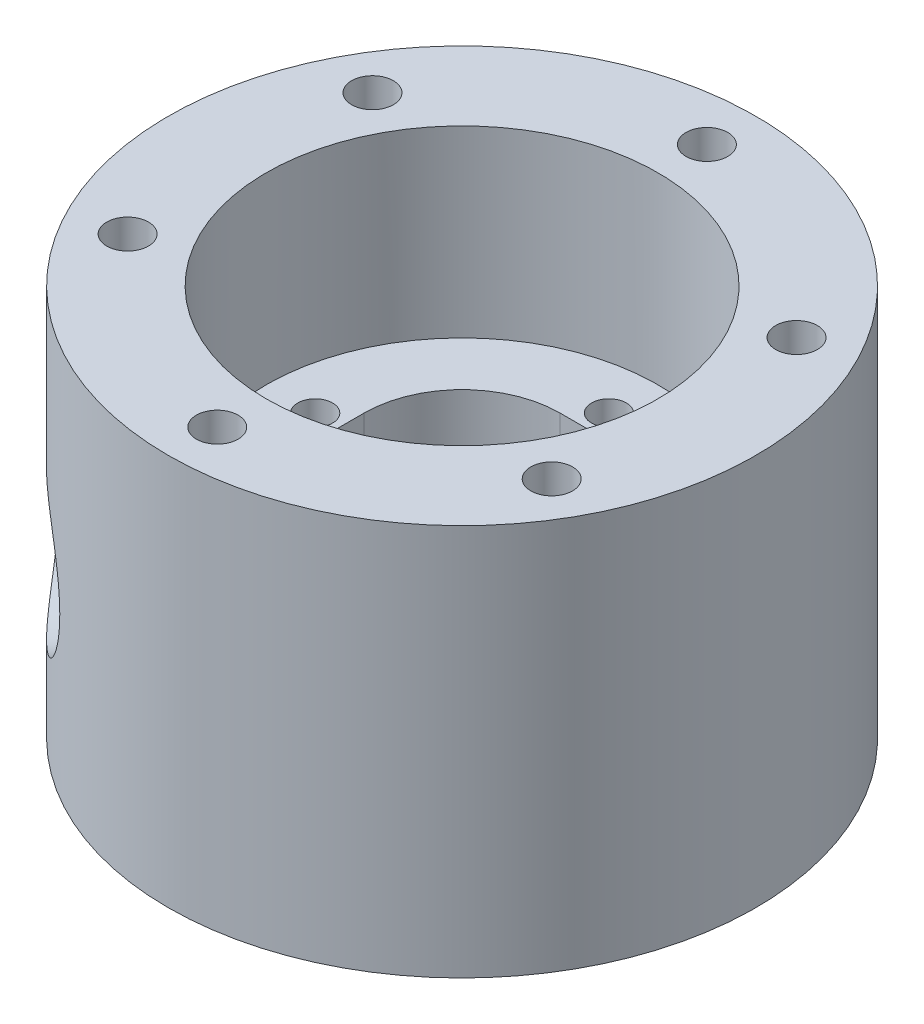
from build123d import *

# Parameters (mm, degrees)
SKETCH1_R             = 19.05
BOSS_EXTRUDE1_DEPTH   = 25.4
SKETCH3_R             = 11.1125
CUT_EXTRUDE1_DEPTH    = 7.14375
CUT_EXTRUDE2_DEPTH    = 18.25625
SKETCH5_R             = 12.7
CUT_EXTRUDE3_DEPTH    = 11.90625
F_4_40_TAPPED_HOLE1_D = 2.2606
CIRPATTERN1_COUNT     = 4
SKETCH8_R             = 4.7625
CUT_EXTRUDE6_DEPTH    = 38.026544532
CIRPATTERN2_COUNT     = 6


with BuildPart() as part:
    # Sketch1 → Boss-Extrude1 (new body)
    with BuildSketch(Plane(origin=(0, 0, 0), x_dir=(1, 0, 0), z_dir=(0, 1, 0))):
        Circle(SKETCH1_R)
    extrude(amount=BOSS_EXTRUDE1_DEPTH)

    # Sketch3 → Cut-Extrude1 (cut)
    with BuildSketch(Plane.XZ):
        Circle(SKETCH3_R)
    extrude(amount=-CUT_EXTRUDE1_DEPTH, mode=Mode.SUBTRACT)

    # Sketch4 → Cut-Extrude2 (cut)
    with BuildSketch(Plane(origin=(0, 25.4, 0), x_dir=(1, 0, 0), z_dir=(0, 1, 0))):
        with BuildLine():
            Line((-1.5875, 7.9375), (1.5875, 7.9375))
            ThreePointArc((1.5875, 7.9375), (6.077628061, 6.077628061), (7.9375, 1.5875))
            Line((7.9375, 1.5875), (7.9375, -1.5875))
            ThreePointArc((7.9375, -1.5875), (6.077628061, -6.077628061), (1.5875, -7.9375))
            Line((1.5875, -7.9375), (-1.5875, -7.9375))
            ThreePointArc((-1.5875, -7.9375), (-6.077628061, -6.077628061), (-7.9375, -1.5875))
            Line((-7.9375, -1.5875), (-7.9375, 1.5875))
            ThreePointArc((-7.9375, 1.5875), (-6.077628061, 6.077628061), (-1.5875, 7.9375))
        make_face()
    extrude(amount=-CUT_EXTRUDE2_DEPTH, mode=Mode.SUBTRACT)

    # Sketch5 → Cut-Extrude3 (cut)
    with BuildSketch(Plane(origin=(0, 25.4, 0), x_dir=(1, 0, 0), z_dir=(0, 1, 0))):
        Circle(SKETCH5_R)
    extrude(amount=-CUT_EXTRUDE3_DEPTH, mode=Mode.SUBTRACT)

    # #4-40 Tapped Hole1 (through all)
    with Locations(Plane(origin=(0, 13.49375, 0), x_dir=(-1, 0, 0), z_dir=(0, 1, 0))):
        with Locations((0, -9.525)):
            f_4_40_tapped_hole1 = Hole(F_4_40_TAPPED_HOLE1_D / 2)

    # CirPattern1: #4-40 Tapped Hole1 ×4 about axis
    cirpattern1_axis = Axis((0, 25.4, 0), (0, 1, 0))
    for i in range(1, CIRPATTERN1_COUNT):
        add(f_4_40_tapped_hole1.rotate(cirpattern1_axis, i * 360 / CIRPATTERN1_COUNT), mode=Mode.SUBTRACT)

    # Sketch8 → Cut-Extrude6 (cut, through all)
    with BuildSketch(Plane(origin=(0, 0, 0), x_dir=(-0.7071067811865488, 0, -0.7071067811865464), z_dir=(0.7071067811865464, 0, -0.7071067811865488))):
        with Locations((0, 10.31875)):
            Circle(SKETCH8_R)
    extrude(amount=-CUT_EXTRUDE6_DEPTH, mode=Mode.SUBTRACT)

    # Sketch9 → #6-32 Tapped Hole1 (revolve, cut)
    with BuildSketch(Plane(origin=(0, 25.4, -15.875), x_dir=(0, 0, 1), z_dir=(1, 0, 0))):
        Polygon((0, 0), (0, 11.98869403), (1.35255, 11.176), (1.35255, 0), align=None)
    f_6_32_tapped_hole1 = revolve(axis=Axis((0, 31.75, -15.875), (0, -1, 0)), mode=Mode.SUBTRACT)

    # CirPattern2: #6-32 Tapped Hole1 ×6 about axis
    cirpattern2_axis = Axis((0, 13.49375, 0), (0, 1, 0))
    for i in range(1, CIRPATTERN2_COUNT):
        add(f_6_32_tapped_hole1.rotate(cirpattern2_axis, i * 360 / CIRPATTERN2_COUNT), mode=Mode.SUBTRACT)


solid = part.part
